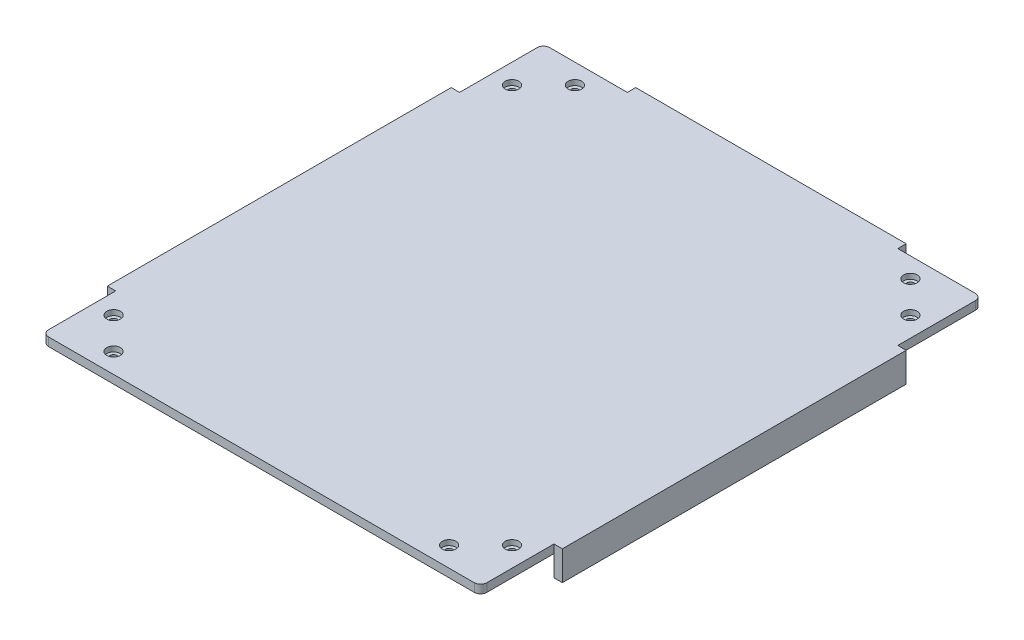
from build123d import *

# Parameters (mm, degrees)
SKETCH1_W                              = 209
SKETCH1_H                              = 239
BASE_PLATE_DEPTH                       = 4
MOUNTING_HOLES_START                   = 1.5
MOUNTING_HOLES_OUTLINE_R               = 3.25
MOUNTING_HOLES_DEPTH                   = 2.5
MOUNTING_HOLES_2_OUTLINE_R             = 1.7
MOUNTING_HOLES_2_DEPTH                 = 1.5
MOUNTING_HOLES_MIRROR2_START           = 1.5
MOUNTING_HOLES_MIRROR2_COPY_1_SKETCH_R = 3.25
MOUNTING_HOLES_MIRROR2_COPY_1_DEPTH    = 2.5
MOUNTING_HOLES_MIRROR2_COPY_2_SKETCH_R = 1.7
MOUNTING_HOLES_MIRROR2_COPY_2_DEPTH    = 1.5
MOUNTING_HOLES_MIRROR2_COPY_3_SKETCH_R = 1.7
MOUNTING_HOLES_MIRROR2_COPY_3_DEPTH    = 1.5
SKETCH5_W                              = 129
SKETCH5_H                              = 4
SIDE_EXTRUSION_DEPTH                   = 14
SKETCH6_W                              = 4
SKETCH6_H                              = 164
UPPER_LOWER_EXTRUSION_DEPTH            = 14
EDGE_FILLETS_R                         = 3


# Read off the part's stored shape, not the designer's step: mounting_holes
with BuildPart() as part:
    # Sketch1 → base_plate (new body)
    with BuildSketch(Plane(origin=(0, 0, 0), x_dir=(1, 0, 0), z_dir=(0, 1, 0))):
        Rectangle(SKETCH1_W, SKETCH1_H)
    extrude(amount=BASE_PLATE_DEPTH)

    # mounting_holes outline → mounting_holes (cut)
    with BuildSketch(Plane(origin=(0, 0, 0), x_dir=(1, 0, 0), z_dir=(0, 1, 0)).offset(MOUNTING_HOLES_START)):
        with Locations((95, 95)):
            Circle(MOUNTING_HOLES_OUTLINE_R)
        with Locations((80, 110)):
            Circle(MOUNTING_HOLES_OUTLINE_R)
    mounting_holes = extrude(amount=MOUNTING_HOLES_DEPTH, mode=Mode.SUBTRACT)

    # mounting_holes 2 outline → mounting_holes 2 (cut)
    with BuildSketch(Plane(origin=(0, 0, 0), x_dir=(1, 0, 0), z_dir=(0, 1, 0))):
        with Locations((95, 95)):
            Circle(MOUNTING_HOLES_2_OUTLINE_R)
        with Locations((80, 110)):
            Circle(MOUNTING_HOLES_2_OUTLINE_R)
    mounting_holes_2 = extrude(amount=MOUNTING_HOLES_2_DEPTH, mode=Mode.SUBTRACT)

    # mounting_holes_mirror1: mounting_holes, mounting_holes 2 across plane
    add(mounting_holes.mirror(Plane.XY), mode=Mode.SUBTRACT)
    add(mounting_holes_2.mirror(Plane.XY), mode=Mode.SUBTRACT)

    # mounting_holes_mirror2: mounting_holes, mounting_holes 2 across plane
    add(mounting_holes.mirror(Plane(origin=(0, 0, 0), x_dir=(0, 0, 1), z_dir=(1, 0, 0))), mode=Mode.SUBTRACT)
    add(mounting_holes_2.mirror(Plane(origin=(0, 0, 0), x_dir=(0, 0, 1), z_dir=(1, 0, 0))), mode=Mode.SUBTRACT)

    # mounting_holes_mirror2 copy 1 sketch → mounting_holes_mirror2 copy 1 (cut)
    with BuildSketch(Plane(origin=(0, 0, 0), x_dir=(-1, 0, 0), z_dir=(0, 1, 0)).offset(MOUNTING_HOLES_MIRROR2_START)):
        with Locations((95, 95)):
            Circle(MOUNTING_HOLES_MIRROR2_COPY_1_SKETCH_R)
        with Locations((80, 110)):
            Circle(MOUNTING_HOLES_MIRROR2_COPY_1_SKETCH_R)
    extrude(amount=MOUNTING_HOLES_MIRROR2_COPY_1_DEPTH, mode=Mode.SUBTRACT)

    # mounting_holes_mirror2 copy 2 sketch → mounting_holes_mirror2 copy 2 (cut)
    with BuildSketch(Plane(origin=(0, 0, 0), x_dir=(-1, 0, 0), z_dir=(0, 1, 0))):
        with Locations((95, 95)):
            Circle(MOUNTING_HOLES_MIRROR2_COPY_2_SKETCH_R)
        with Locations((80, 110)):
            Circle(MOUNTING_HOLES_MIRROR2_COPY_2_SKETCH_R)
    extrude(amount=MOUNTING_HOLES_MIRROR2_COPY_2_DEPTH, mode=Mode.SUBTRACT)

    # mounting_holes_mirror2 copy 3 sketch → mounting_holes_mirror2 copy 3 (cut)
    with BuildSketch(Plane(origin=(0, 0, 0), x_dir=(-1, 0, 0), z_dir=(0, 1, 0))):
        with Locations((95, -95)):
            Circle(MOUNTING_HOLES_MIRROR2_COPY_3_SKETCH_R)
        with Locations((80, -110)):
            Circle(MOUNTING_HOLES_MIRROR2_COPY_3_SKETCH_R)
    extrude(amount=MOUNTING_HOLES_MIRROR2_COPY_3_DEPTH, mode=Mode.SUBTRACT)

    # Sketch5 → side_extrusion (add)
    with BuildSketch(Plane(origin=(0, 4, 0), x_dir=(1, 0, 0), z_dir=(0, 1, 0))):
        with Locations((0, 121.5)):
            Rectangle(SKETCH5_W, SKETCH5_H)
    extrude(amount=-SIDE_EXTRUSION_DEPTH)

    # Sketch6 → upper_lower_extrusion (add)
    with BuildSketch(Plane(origin=(0, 4, 0), x_dir=(1, 0, 0), z_dir=(0, 1, 0))):
        with Locations((-106.5, -2.5)):
            Rectangle(SKETCH6_W, SKETCH6_H)
        with Locations((106.5, -2.5)):
            Rectangle(SKETCH6_W, SKETCH6_H)
    extrude(amount=-UPPER_LOWER_EXTRUSION_DEPTH)

    # edge_fillets
    edge_fillets_edges = [part.edges().sort_by_distance(p)[0] for p in [
        (104.5, 2, 119.5),
        (-104.5, 2, 119.5),
        (-104.5, 2, -119.5),
        (104.5, 2, -119.5),
    ]]
    fillet(edge_fillets_edges, radius=EDGE_FILLETS_R)


solid = part.part
